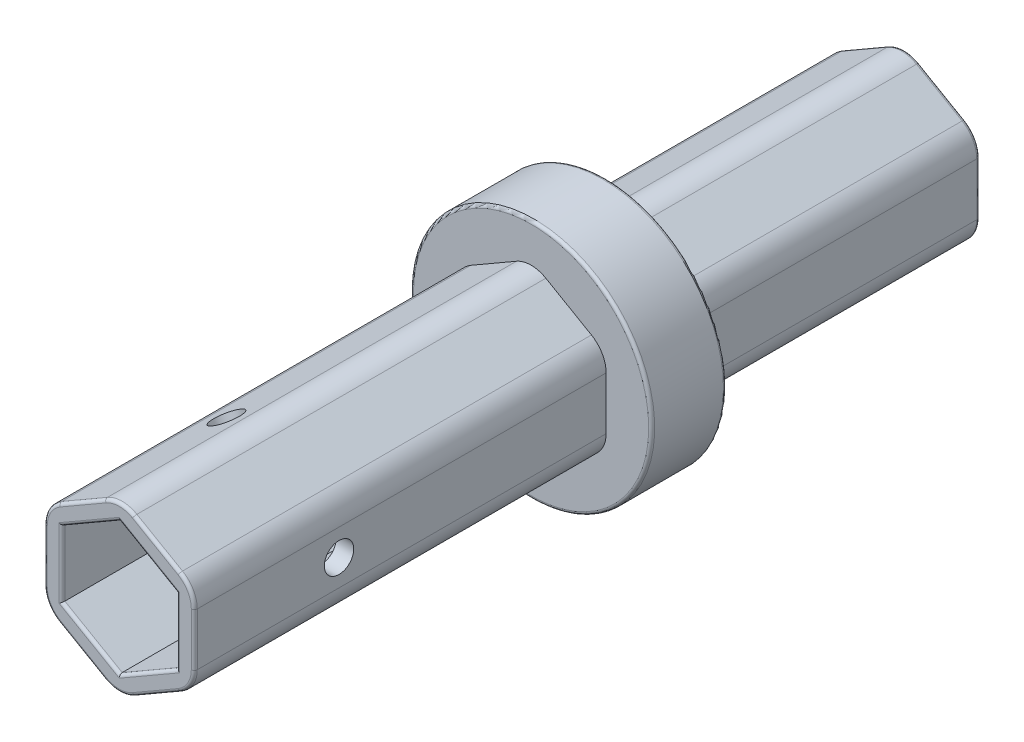
from build123d import *

# Parameters (mm, degrees)
SKETCH2_W          = 10.25
SKETCH2_H          = 6.35
BOTTOMSHAFT_DEPTH  = 25.4
TOPSHAFT_DEPTH     = 35
CUT_EXTRUDE1_DEPTH = 69.305837964
MOUNTHOLE_REACH    = 60.259
MOUNTHOLE_BORE_R   = 1.25
MOUNTHOLES_COUNT   = 3
FILLET1_R          = 0.254
FILLET2_R          = 2.5


with BuildPart() as part:
    # Sketch2 → Collar (revolve)
    with BuildSketch(Plane(origin=(0, 0, 0), x_dir=(1, 0, 0), z_dir=(0, 1, 0)), mode=Mode.PRIVATE) as collar_sk:
        with Locations((5.125, 3.175)):
            Rectangle(SKETCH2_W, SKETCH2_H)
    revolve(collar_sk.sketch.rotate(Axis((0, 0, -6.35), (0, 0, 1)), 180), axis=Axis((0, 0, -6.35), (0, 0, 1)))

    # Sketch3 → BottomShaft (add)
    with BuildSketch(Plane(origin=(0, 0, -6.35), x_dir=(-1, 0, 0), z_dir=(0, 0, -1))):
        Polygon((-6.375, -3.680607966), (0, -7.361215932), (6.375, -3.680607966), (6.375, 3.680607966), (0, 7.361215932), (-6.375, 3.680607966), align=None)
    extrude(amount=BOTTOMSHAFT_DEPTH)

    # Sketch4 → TopShaft (add)
    with BuildSketch(Plane.XY):
        Polygon((0, -7.361215932), (6.375, -3.680607966), (6.375, 3.680607966), (0, 7.361215932), (-6.375, 3.680607966), (-6.375, -3.680607966), align=None)
    extrude(amount=TOPSHAFT_DEPTH)

    # Sketch5 → Cut-Extrude1 (cut, through all)
    with BuildSketch(Plane.XY.offset(35)):
        Polygon((-4.875, -2.814582562), (0, -5.629165125), (4.875, -2.814582562), (4.875, 2.814582562), (0, 5.629165125), (-4.875, 2.814582562), align=None)
    extrude(amount=-CUT_EXTRUDE1_DEPTH, mode=Mode.SUBTRACT)

    # MountHole bore (on position points) → MountHole (cut, up to next)
    with BuildSketch(Plane(origin=(-3.1875, 5.520911949, 22.7), x_dir=(0.866025403784, 0.5, 0), z_dir=(-0.5, 0.866025403784, 0)), mode=Mode.PRIVATE) as mounthole_sk1:
        Circle(MOUNTHOLE_BORE_R)
    mounthole_tool1 = extrude(mounthole_sk1.sketch, amount=-MOUNTHOLE_REACH, mode=Mode.PRIVATE) & part.part
    mounthole = mounthole_tool1.solids().sort_by_distance((-3.1875, 5.520912, 22.7))[0]
    add(mounthole, mode=Mode.SUBTRACT)

    # MountHoleS: MountHole ×3 about axis
    mountholes_axis = Axis((0, 0, -6.35), (0, 0, -1))
    for i in range(1, MOUNTHOLES_COUNT):
        add(mounthole.rotate(mountholes_axis, i * 360 / MOUNTHOLES_COUNT), mode=Mode.SUBTRACT)

    # Fillet1
    fillet1_edges = [part.edges().sort_by_distance(p)[0] for p in [
        (6.375, 0, -31.75),
        (3.1875, -5.520911949, -31.75),
        (-3.1875, -5.520911949, -31.75),
        (-6.375, 0, -31.75),
        (-3.1875, 5.520911949, -31.75),
        (3.1875, 5.520911949, -31.75),
        (-3.1875, -5.520911949, 35),
        (3.1875, -5.520911949, 35),
        (6.375, 0, 35),
        (3.1875, 5.520911949, 35),
        (-3.1875, 5.520911949, 35),
        (-6.375, 0, 35),
        (10.25, 0, 0),
        (10.25, 0, -6.35),
        (-2.4375, -4.221873843, -31.75),
        (-4.875, 0, -31.75),
        (-2.4375, 4.221873843, -31.75),
        (2.4375, 4.221873843, -31.75),
        (4.875, 0, -31.75),
        (2.4375, -4.221873843, -31.75),
        (-2.4375, -4.221873843, 35),
        (2.4375, -4.221873843, 35),
        (4.875, 0, 35),
        (2.4375, 4.221873843, 35),
        (-2.4375, 4.221873843, 35),
        (-4.875, 0, 35),
    ]]
    fillet(fillet1_edges, radius=FILLET1_R)

    # Fillet2
    # the kernel refuses this fillet: 2.5 mm, written as the material it takes off along each edge
    with BuildSketch(Plane(origin=(-3.875, -2.237232293, -31.75), x_dir=(-0.5000000000000004, -0.8660254037844384, 0), z_dir=(0.8660254037844384, -0.5000000000000004, 0))) as fillet2_piece_1:
        with BuildLine():
            CenterArc((2.246, -0.254), 0.254, 0, 90)
            Line((2.5, -0.254), (2.5, 0))
            Line((2.5, 0), (2.246, 0))
        make_face()
    revolve(axis=Axis((-3.875, -2.237232293, -31.75), (0, 0, -1)), revolution_arc=60, mode=Mode.SUBTRACT)
    with BuildSketch(Plane(origin=(0, -4.474464586, -31.75), x_dir=(0.5000000000000002, -0.8660254037844386, 0), z_dir=(0.8660254037844386, 0.5000000000000002, 0))) as fillet2_piece_2:
        with BuildLine():
            CenterArc((2.246, -0.254), 0.254, 0, 90)
            Line((2.5, -0.254), (2.5, 0))
            Line((2.5, 0), (2.246, 0))
        make_face()
    revolve(axis=Axis((0, -4.474464586, -31.75), (0, 0, -1)), revolution_arc=60, mode=Mode.SUBTRACT)
    with BuildSketch(Plane(origin=(-3.875, 2.237232293, -31.75), x_dir=(-1, 0, 0), z_dir=(0, -1, 0))) as fillet2_piece_3:
        with BuildLine():
            CenterArc((2.246, -0.254), 0.254, 0, 90)
            Line((2.5, -0.254), (2.5, 0))
            Line((2.5, 0), (2.246, 0))
        make_face()
    revolve(axis=Axis((-3.875, 2.237232293, -31.75), (0, 0, -1)), revolution_arc=60, mode=Mode.SUBTRACT)
    with BuildSketch(Plane(origin=(3.875, -2.237232293, -31.75), x_dir=(1, 0, 0), z_dir=(0, 1, 0))) as fillet2_piece_4:
        with BuildLine():
            CenterArc((2.246, -0.254), 0.254, 0, 90)
            Line((2.5, -0.254), (2.5, 0))
            Line((2.5, 0), (2.246, 0))
        make_face()
    revolve(axis=Axis((3.875, -2.237232293, -31.75), (0, 0, -1)), revolution_arc=60, mode=Mode.SUBTRACT)
    with BuildSketch(Plane(origin=(0, 4.474464586, -31.75), x_dir=(-0.5, 0.8660254037844387, 0), z_dir=(-0.8660254037844387, -0.5, 0))) as fillet2_piece_5:
        with BuildLine():
            CenterArc((2.246, -0.254), 0.254, 0, 90)
            Line((2.5, -0.254), (2.5, 0))
            Line((2.5, 0), (2.246, 0))
        make_face()
    revolve(axis=Axis((0, 4.474464586, -31.75), (0, 0, -1)), revolution_arc=60, mode=Mode.SUBTRACT)
    with BuildSketch(Plane(origin=(3.875, 2.237232293, -31.75), x_dir=(0.5000000000000001, 0.8660254037844386, 0), z_dir=(-0.8660254037844386, 0.5000000000000001, 0))) as fillet2_piece_6:
        with BuildLine():
            CenterArc((2.246, -0.254), 0.254, 0, 90)
            Line((2.5, -0.254), (2.5, 0))
            Line((2.5, 0), (2.246, 0))
        make_face()
    revolve(axis=Axis((3.875, 2.237232293, -31.75), (0, 0, -1)), revolution_arc=60, mode=Mode.SUBTRACT)
    with BuildSketch(Plane(origin=(3.875, 2.237232293, 35), x_dir=(1, 0, 0), z_dir=(0, -1, 0))) as fillet2_piece_7:
        with BuildLine():
            CenterArc((2.246, -0.254), 0.254, 0, 90)
            Line((2.5, -0.254), (2.5, 0))
            Line((2.5, 0), (2.246, 0))
        make_face()
    revolve(axis=Axis((3.875, 2.237232293, 35), (0, 0, 1)), revolution_arc=60, mode=Mode.SUBTRACT)
    with BuildSketch(Plane(origin=(3.875, -2.237232293, 35), x_dir=(0.4999999999999999, -0.8660254037844387, 0), z_dir=(-0.8660254037844387, -0.4999999999999999, 0))) as fillet2_piece_8:
        with BuildLine():
            CenterArc((2.246, -0.254), 0.254, 0, 90)
            Line((2.5, -0.254), (2.5, 0))
            Line((2.5, 0), (2.246, 0))
        make_face()
    revolve(axis=Axis((3.875, -2.237232293, 35), (0, 0, 1)), revolution_arc=60, mode=Mode.SUBTRACT)
    with BuildSketch(Plane(origin=(0, 4.474464586, 35), x_dir=(0.49999999999999994, 0.8660254037844389, 0), z_dir=(0.8660254037844389, -0.49999999999999994, 0))) as fillet2_piece_9:
        with BuildLine():
            CenterArc((2.246, -0.254), 0.254, 0, 90)
            Line((2.5, -0.254), (2.5, 0))
            Line((2.5, 0), (2.246, 0))
        make_face()
    revolve(axis=Axis((0, 4.474464586, 35), (0, 0, 1)), revolution_arc=60, mode=Mode.SUBTRACT)
    with BuildSketch(Plane(origin=(0, -4.474464586, 35), x_dir=(-0.5000000000000001, -0.8660254037844387, 0), z_dir=(-0.8660254037844387, 0.5000000000000001, 0))) as fillet2_piece_10:
        with BuildLine():
            CenterArc((2.246, -0.254), 0.254, 0, 90)
            Line((2.5, -0.254), (2.5, 0))
            Line((2.5, 0), (2.246, 0))
        make_face()
    revolve(axis=Axis((0, -4.474464586, 35), (0, 0, 1)), revolution_arc=60, mode=Mode.SUBTRACT)
    with BuildSketch(Plane(origin=(-3.875, 2.237232293, 35), x_dir=(-0.5, 0.8660254037844387, 0), z_dir=(0.8660254037844387, 0.5, 0))) as fillet2_piece_11:
        with BuildLine():
            CenterArc((2.246, -0.254), 0.254, 0, 90)
            Line((2.5, -0.254), (2.5, 0))
            Line((2.5, 0), (2.246, 0))
        make_face()
    revolve(axis=Axis((-3.875, 2.237232293, 35), (0, 0, 1)), revolution_arc=60, mode=Mode.SUBTRACT)
    with BuildSketch(Plane(origin=(-3.875, -2.237232293, 35), x_dir=(-1, 0, 0), z_dir=(0, 1, 0))) as fillet2_piece_12:
        with BuildLine():
            CenterArc((2.246, -0.254), 0.254, 0, 90)
            Line((2.5, -0.254), (2.5, 0))
            Line((2.5, 0), (2.246, 0))
        make_face()
    revolve(axis=Axis((-3.875, -2.237232293, 35), (0, 0, 1)), revolution_arc=60, mode=Mode.SUBTRACT)
    with BuildSketch(Plane(origin=(-6.375, -3.680607966, 0), x_dir=(0, 1, 0), z_dir=(0, 0, 1)), Plane(origin=(-6.375, 3.680607966, 0), x_dir=(0.8660254037844388, 0.49999999999999956, 0), z_dir=(0, 0, 1)), Plane(origin=(0, 7.361215932, 0), x_dir=(0.8660254037844389, -0.4999999999999996, 0), z_dir=(0, 0, 1)), Plane(origin=(6.375, 3.680607966, 0), x_dir=(0, -1, 0), z_dir=(0, 0, 1)), Plane(origin=(6.375, -3.680607966, 0), x_dir=(-0.8660254037844388, -0.49999999999999956, 0), z_dir=(0, 0, 1))) as fillet2_piece_13:
        with BuildLine():
            CenterArc((FILLET2_R * 0.57735026919, -FILLET2_R), FILLET2_R, 90, 60)
            Line((-FILLET2_R * 0.288675134595, -FILLET2_R * 0.5), (0, 0))
            Line((0, 0), (FILLET2_R * 0.57735026919, 0))
        make_face()
    extrude(amount=35, mode=Mode.SUBTRACT)
    with BuildSketch(Plane(origin=(0, -7.361215932, 0), x_dir=(0.8660254037844388, 0.49999999999999983, 0), z_dir=(0, 0, 1))) as fillet2_piece_14:
        with BuildLine():
            CenterArc((FILLET2_R * 0.57735026919, FILLET2_R), FILLET2_R, 210, 60)
            Line((-FILLET2_R * 0.288675134595, FILLET2_R * 0.5), (0, 0))
            Line((0, 0), (FILLET2_R * 0.57735026919, 0))
        make_face()
    extrude(amount=35, mode=Mode.SUBTRACT)
    with BuildSketch(Plane(origin=(6.375, 3.680607966, -6.35), x_dir=(-0.8660254037844386, 0.5000000000000003, 0), z_dir=(0, 0, -1)), Plane(origin=(0, 7.361215932, -6.35), x_dir=(-0.8660254037844387, -0.49999999999999994, 0), z_dir=(0, 0, -1)), Plane(origin=(-6.375, 3.680607966, -6.35), x_dir=(0, -1, 0), z_dir=(0, 0, -1)), Plane(origin=(-6.375, -3.680607966, -6.35), x_dir=(0.8660254037844386, -0.5000000000000003, 0), z_dir=(0, 0, -1)), Plane(origin=(0, -7.361215932, -6.35), x_dir=(0.8660254037844386, 0.5, 0), z_dir=(0, 0, -1))) as fillet2_piece_15:
        with BuildLine():
            CenterArc((FILLET2_R * 0.57735026919, -FILLET2_R), FILLET2_R, 90, 60)
            Line((-FILLET2_R * 0.288675134595, -FILLET2_R * 0.5), (0, 0))
            Line((0, 0), (FILLET2_R * 0.57735026919, 0))
        make_face()
    extrude(amount=25.4, mode=Mode.SUBTRACT)
    with BuildSketch(Plane(origin=(6.375, -3.680607966, -6.35), x_dir=(-0.8660254037844385, -0.5000000000000003, 0), z_dir=(0, 0, -1))) as fillet2_piece_16:
        with BuildLine():
            CenterArc((FILLET2_R * 0.57735026919, FILLET2_R), FILLET2_R, 210, 60)
            Line((-FILLET2_R * 0.288675134595, FILLET2_R * 0.5), (0, 0))
            Line((0, 0), (FILLET2_R * 0.57735026919, 0))
        make_face()
    extrude(amount=25.4, mode=Mode.SUBTRACT)


solid = part.part
